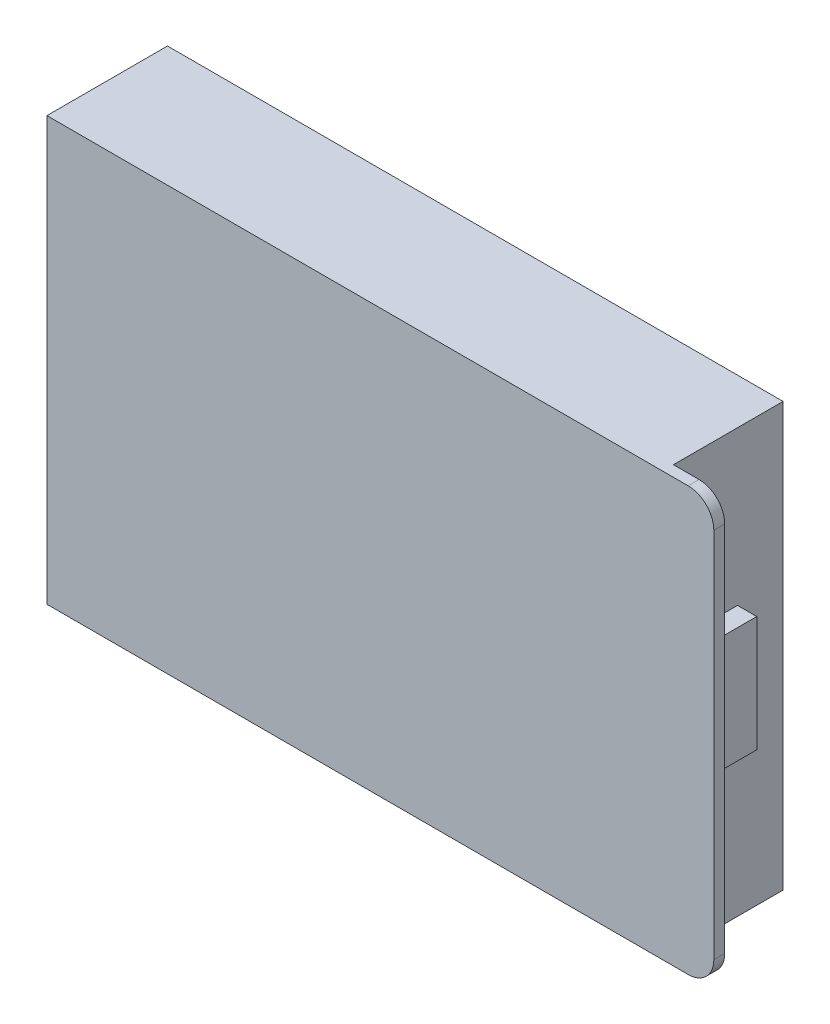
from build123d import *

# Parameters (mm, degrees)
SKETCH1_W           = 96
SKETCH1_H           = 66
BOSS_EXTRUDE1_DEPTH = 17.1
BOSS_EXTRUDE2_DEPTH = 1.7
SKETCH3_W           = 10
SKETCH3_H           = 18
BOSS_EXTRUDE3_DEPTH = 3


with BuildPart() as part:
    # Sketch1 → Boss-Extrude1 (new body)
    with BuildSketch(Plane.XY):
        Rectangle(SKETCH1_W, SKETCH1_H)
    extrude(amount=BOSS_EXTRUDE1_DEPTH)

    # Sketch2 → Boss-Extrude2 (add)
    with BuildSketch(Plane.XY.offset(17.1)):
        with BuildLine():
            Line((-48, 33), (52, 33))
            ThreePointArc((52, 33), (54.828427125, 31.828427125), (56, 29))
            Line((56, 29), (56, -29))
            ThreePointArc((56, -29), (54.828427125, -31.828427125), (52, -33))
            Line((52, -33), (-48, -33))
            Line((-48, -33), (-48, 33))
        make_face()
    extrude(amount=BOSS_EXTRUDE2_DEPTH)

    # Sketch3 → Boss-Extrude3 (add)
    with BuildSketch(Plane(origin=(48, 0, 0), x_dir=(0, 0, -1), z_dir=(1, 0, 0))):
        with Locations((-12.1, 0)):
            Rectangle(SKETCH3_W, SKETCH3_H)
    extrude(amount=BOSS_EXTRUDE3_DEPTH)


solid = part.part
